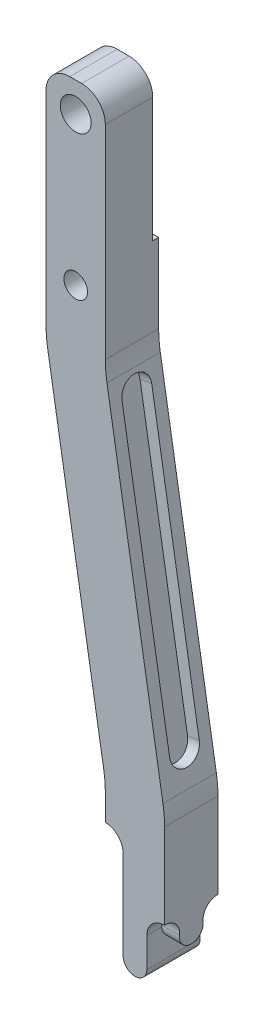
from build123d import *

# Parameters (mm, degrees)
SKETCH1_R           = 2
SKETCH1_R_2         = 2.6
BOSS_EXTRUDE1_DEPTH = 9
FILLET1_R           = 4
SKETCH3_W           = 1
SKETCH3_H           = 25
CUT_EXTRUDE2_DEPTH  = 131.694299799
CUT_EXTRUDE3_DEPTH  = 132.837020597
BOSS_EXTRUDE2_DEPTH = 3
BOSS_EXTRUDE4_DEPTH = 5
CUT_EXTRUDE4_DEPTH  = 2
FILLET2_R           = 20
FILLET3_R           = 4


with BuildPart() as part:
    # Sketch1 → Boss-Extrude1 (new body)
    with BuildSketch(Plane.XY):
        Polygon((0, 0), (-10, 0), (-10, 30), (-20, 90), (-20, 130), (-10, 130), (-10, 90), (0, 30), align=None)
        with Locations((-15, 100)):
            Circle(SKETCH1_R, mode=Mode.SUBTRACT)
        with Locations((-15, 125)):
            Circle(SKETCH1_R_2, mode=Mode.SUBTRACT)
    extrude(amount=BOSS_EXTRUDE1_DEPTH)

    # Fillet1
    fillet1_edges = [part.edges().sort_by_distance(p)[0] for p in [
        (0, 0, 4.5),
        (-10, 0, 4.5),
    ]]
    fillet(fillet1_edges, radius=FILLET1_R)

    # Sketch3 → Cut-Extrude2 (cut, through all)
    with BuildSketch(Plane.ZY.offset(10)):
        with Locations((0.5, 117.5)):
            Rectangle(SKETCH3_W, SKETCH3_H)
    extrude(amount=CUT_EXTRUDE2_DEPTH, mode=Mode.SUBTRACT)

    # Sketch5 → Cut-Extrude3 (cut, through all)
    with BuildSketch(Plane.XY.offset(9)):
        with BuildLine():
            Line((-10, 4), (-10, 24))
            ThreePointArc((-10, 24), (-7.878679656, 23.121320344), (-7, 21))
            Line((-7, 21), (-7, 6))
            ThreePointArc((-7, 6), (-5, 4), (-3, 6))
            Line((-3, 6), (-3, 10.96659189))
            ThreePointArc((-3, 10.96659189), (-2.121320344, 13.087912234), (0, 13.96659189))
            Line((0, 13.96659189), (0, 4))
            ThreePointArc((0, 4), (-1.171572875, 1.171572875), (-4, 0))
            Line((-4, 0), (-6, 0))
            ThreePointArc((-6, 0), (-8.828427125, 1.171572875), (-10, 4))
        make_face()
    extrude(amount=-CUT_EXTRUDE3_DEPTH, mode=Mode.SUBTRACT)

    # Boss-Extrude2: read off the stored shape, not the designer's step
    # Boss-Extrude2 outline → Boss-Extrude2 (add)
    with BuildSketch(Plane.ZY):
        with BuildLine():
            Line((9, 13.96659189), (9, 30))
            Line((9, 30), (0, 30))
            Line((0, 30), (0, 13.96659189))
            Line((0, 13.96659189), (0.423395215, 13.96659189))
            ThreePointArc((0.423395215, 13.96659189), (2.009052541, 13.008624555), (2.499994655, 11.222291324))
            ThreePointArc((2.499994655, 11.222291324), (4.487608253, 9.000047793), (6.47522185, 11.222291324))
            ThreePointArc((6.47522185, 11.222291324), (6.966163965, 13.008624555), (8.551821291, 13.96659189))
            Line((8.551821291, 13.96659189), (9, 13.96659189))
        make_face()
    extrude(amount=BOSS_EXTRUDE2_DEPTH)

    # Sketch8 → Boss-Extrude4 (add)
    with BuildSketch(Plane.ZY.offset(10)):
        with BuildLine():
            Line((2.5, 21.5), (6.5, 21.5))
            ThreePointArc((6.5, 21.5), (4.5, 19.5), (2.5, 21.5))
        make_face()
        with BuildLine():
            ThreePointArc((0, 24), (1.767766953, 23.267766953), (2.5, 21.5))
            Line((2.5, 21.5), (6.5, 21.5))
            ThreePointArc((6.5, 21.5), (7.232233047, 23.267766953), (9, 24))
            Line((9, 24), (0, 24))
        make_face()
    extrude(amount=-BOSS_EXTRUDE4_DEPTH)

    # Sketch9 → Cut-Extrude4 (cut)
    with BuildSketch(Plane(origin=(4.931969619, 0.408182285, 0), x_dir=(0, 0, -1), z_dir=(0.9863939238321437, 0.16439898730535749, 0))):
        with BuildLine():
            Line((-7, 37), (-7, 85.827625303))
            ThreePointArc((-7, 85.827625303), (-4.5, 88.327625303), (-2, 85.827625303))
            Line((-2, 85.827625303), (-2, 37))
            ThreePointArc((-2, 37), (-4.5, 34.5), (-7, 37))
        make_face()
    cut_extrude4 = extrude(amount=-CUT_EXTRUDE4_DEPTH, mode=Mode.SUBTRACT)

    # Mirror1: Cut-Extrude4 across plane
    add(cut_extrude4.mirror(Plane(origin=(0, 0, 0), x_dir=(0, 0, 1), z_dir=(0.9863939238321437, 0.16439898730535743, 0))), mode=Mode.SUBTRACT)

    # Fillet2
    fillet2_edges = [part.edges().sort_by_distance(p)[0] for p in [
        (-10, 30, 4.5),
        (-20, 90, 4.5),
        (-10, 90, 4.5),
        (0, 30, 4.5),
    ]]
    fillet(fillet2_edges, radius=FILLET2_R)

    # Fillet3
    fillet3_edges = [part.edges().sort_by_distance(p)[0] for p in [
        (-20, 130, 5),
        (-10, 130, 5),
    ]]
    fillet(fillet3_edges, radius=FILLET3_R)


solid = part.part
